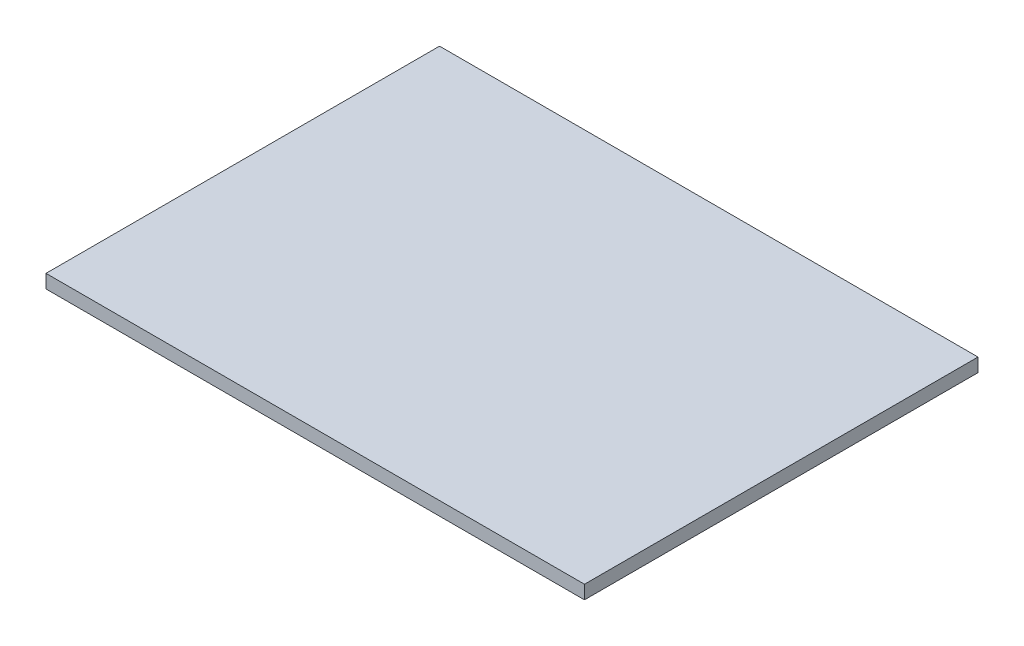
from build123d import *

# Parameters (mm, degrees)
SKETCH_1_W      = 79.5
SKETCH_1_H      = 58.1
EXTRUDE_1_DEPTH = 2


with BuildPart() as part:
    # Эскиз1 → Бобышка-Вытянуть1 (new body)
    with BuildSketch(Plane(origin=(0, 0, 0), x_dir=(1, 0, 0), z_dir=(0, 1, 0))):
        Rectangle(SKETCH_1_W, SKETCH_1_H)
    extrude(amount=EXTRUDE_1_DEPTH)


solid = part.part
